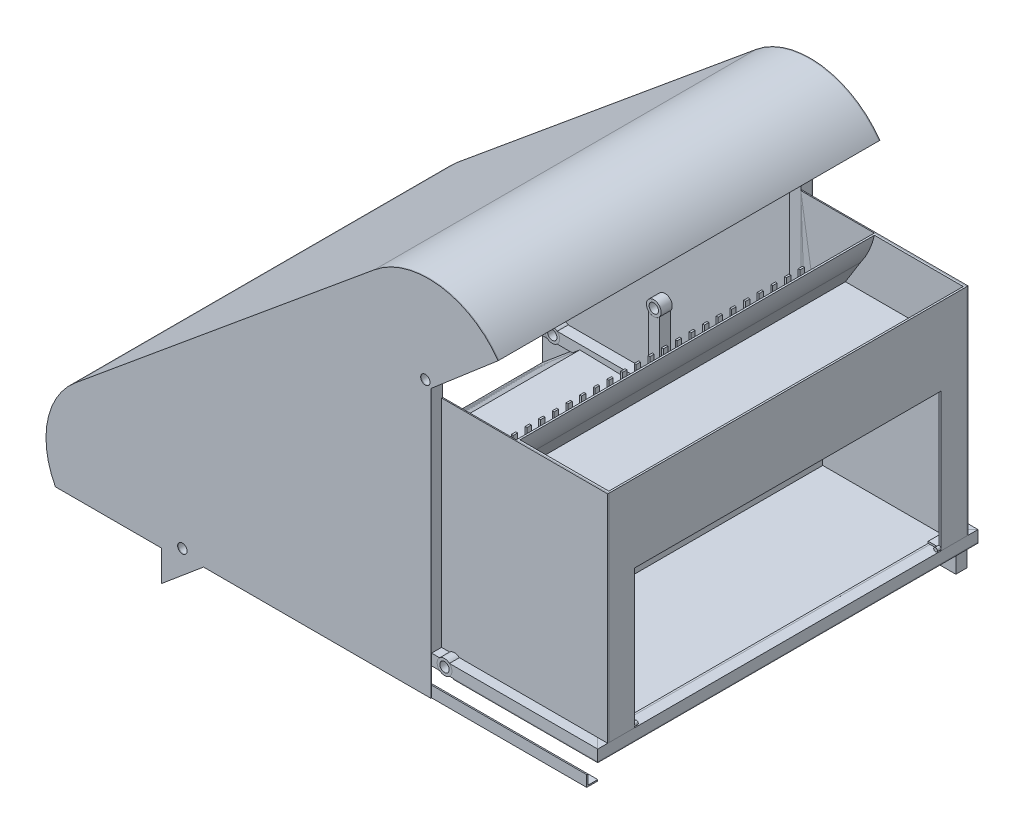
from build123d import *

# Parameters (mm, degrees)
RECTANGULAR_TUBE_SABOSQUARE_1_DEPTH      = 322.213254986
RECTANGULAR_TUBE_SABOSQUARE_1_DEPTH_BACK = 22.213203436
SKETCH11_W                               = 30
SKETCH11_H                               = 30
SKETCH11_W_2                             = 26
SKETCH11_H_2                             = 26
SKETCH11_ON_SEGMENT_2_W                  = 30
SKETCH11_ON_SEGMENT_2_H                  = 30
SKETCH11_ON_SEGMENT_2_W_2                = 26
SKETCH11_ON_SEGMENT_2_H_2                = 26
RECTANGULAR_TUBE_SABOSQUARE_1_2_DEPTH    = 1044.426406874
SKETCH11_ON_SEGMENT_3_W                  = 30
SKETCH11_ON_SEGMENT_3_H                  = 30
SKETCH11_ON_SEGMENT_3_W_2                = 26
SKETCH11_ON_SEGMENT_3_H_2                = 26
RECTANGULAR_TUBE_SABOSQUARE_1_3_DEPTH    = 344.426355321
SKETCH11_ON_SEGMENT_4_W                  = 30
SKETCH11_ON_SEGMENT_4_H                  = 30
SKETCH11_ON_SEGMENT_4_W_2                = 26
SKETCH11_ON_SEGMENT_4_H_2                = 26
RECTANGULAR_TUBE_SABOSQUARE_1_4_DEPTH    = 119.426406871
SKETCH11_ON_SEGMENT_5_W                  = 30
SKETCH11_ON_SEGMENT_5_H                  = 30
SKETCH11_ON_SEGMENT_5_W_2                = 26
SKETCH11_ON_SEGMENT_5_H_2                = 26
RECTANGULAR_TUBE_SABOSQUARE_1_5_DEPTH    = 553.34474334
SKETCH11_ON_SEGMENT_6_W                  = 30
SKETCH11_ON_SEGMENT_6_H                  = 30
SKETCH11_ON_SEGMENT_6_W_2                = 26
SKETCH11_ON_SEGMENT_6_H_2                = 26
RECTANGULAR_TUBE_SABOSQUARE_1_6_DEPTH    = 119.426406871
SKETCH11_ON_SEGMENT_7_W                  = 30
SKETCH11_ON_SEGMENT_7_H                  = 30
SKETCH11_ON_SEGMENT_7_W_2                = 26
SKETCH11_ON_SEGMENT_7_H_2                = 26
RECTANGULAR_TUBE_SABOSQUARE_1_7_DEPTH    = 694.42640773
SKETCH11_ON_SEGMENT_8_W                  = 30
SKETCH11_ON_SEGMENT_8_H                  = 30
SKETCH11_ON_SEGMENT_8_W_2                = 26
SKETCH11_ON_SEGMENT_8_H_2                = 26
RECTANGULAR_TUBE_SABOSQUARE_1_8_DEPTH    = 1044.426406871
SKETCH11_ON_SEGMENT_9_W                  = 30
SKETCH11_ON_SEGMENT_9_H                  = 30
SKETCH11_ON_SEGMENT_9_W_2                = 26
SKETCH11_ON_SEGMENT_9_H_2                = 26
RECTANGULAR_TUBE_SABOSQUARE_1_9_DEPTH    = 694.426365511
SKETCH11_ON_SEGMENT_10_W                 = 30
SKETCH11_ON_SEGMENT_10_H                 = 30
SKETCH11_ON_SEGMENT_10_W_2               = 26
SKETCH11_ON_SEGMENT_10_H_2               = 26
RECTANGULAR_TUBE_SABOSQUARE_1_10_DEPTH   = 119.426406871
SKETCH11_ON_SEGMENT_11_W                 = 30
SKETCH11_ON_SEGMENT_11_H                 = 30
SKETCH11_ON_SEGMENT_11_W_2               = 26
SKETCH11_ON_SEGMENT_11_H_2               = 26
RECTANGULAR_TUBE_SABOSQUARE_1_11_DEPTH   = 553.347173446
SKETCH11_ON_SEGMENT_12_W                 = 30
SKETCH11_ON_SEGMENT_12_H                 = 30
SKETCH11_ON_SEGMENT_12_W_2               = 26
SKETCH11_ON_SEGMENT_12_H_2               = 26
RECTANGULAR_TUBE_SABOSQUARE_1_12_DEPTH   = 119.426406871
SKETCH12_W                               = 30
SKETCH12_H                               = 30
SKETCH12_W_2                             = 26
SKETCH12_H_2                             = 26
RECTANGULAR_TUBE_SABOSQUARE_3_DEPTH      = 200
SKETCH12_ON_SEGMENT_2_W                  = 30
SKETCH12_ON_SEGMENT_2_H                  = 30
SKETCH12_ON_SEGMENT_2_W_2                = 26
SKETCH12_ON_SEGMENT_2_H_2                = 26
RECTANGULAR_TUBE_SABOSQUARE_3_2_DEPTH    = 200
SKETCH12_ON_SEGMENT_3_W                  = 30
SKETCH12_ON_SEGMENT_3_H                  = 30
SKETCH12_ON_SEGMENT_3_W_2                = 26
SKETCH12_ON_SEGMENT_3_H_2                = 26
RECTANGULAR_TUBE_SABOSQUARE_3_3_DEPTH    = 650
SKETCH12_ON_SEGMENT_4_W                  = 30
SKETCH12_ON_SEGMENT_4_H                  = 30
SKETCH12_ON_SEGMENT_4_W_2                = 26
SKETCH12_ON_SEGMENT_4_H_2                = 26
RECTANGULAR_TUBE_SABOSQUARE_3_4_DEPTH    = 650
SKETCH13_R                               = 20
SKETCH13_R_2                             = 12.7
BOSS_EXTRUDE1_DEPTH                      = 30
BOSS_EXTRUDE1_2_DEPTH                    = 30
BOSS_EXTRUDE1_3_DEPTH                    = 30
BOSS_EXTRUDE1_4_DEPTH                    = 30
BOSS_EXTRUDE1_5_DEPTH                    = 30
SKETCH15_R                               = 20
SKETCH15_R_2                             = 12.7
BOSS_EXTRUDE2_DEPTH                      = 30
BOSS_EXTRUDE2_2_DEPTH                    = 30
BOSS_EXTRUDE2_3_DEPTH                    = 30
BOSS_EXTRUDE2_4_DEPTH                    = 30
BOSS_EXTRUDE2_5_DEPTH                    = 30
TRIM_EXTEND1_START                       = -16
TRIM_EXTEND1_DEPTH                       = 31
TRIM_EXTEND1_START_2                     = 984
TRIM_EXTEND1_2_DEPTH                     = 32
TRIM_EXTEND1_3_OUTLINE_W                 = 30
TRIM_EXTEND1_3_OUTLINE_H                 = 15
TRIM_EXTEND1_3_DEPTH                     = 32
TRIM_EXTEND1_4_OUTLINE_W                 = 30
TRIM_EXTEND1_4_OUTLINE_H                 = 15
TRIM_EXTEND1_4_DEPTH                     = 32
TRIM_EXTEND1_START_3                     = -15
TRIM_EXTEND1_5_DEPTH                     = 30
TRIM_EXTEND1_6_DEPTH                     = 2
TRIM_EXTEND1_START_4                     = 13
TRIM_EXTEND1_7_DEPTH                     = 2
TRIM_EXTEND1_8_DEPTH                     = 30
TRIM_EXTEND1_9_DEPTH                     = 30
TRIM_EXTEND1_10_DEPTH                    = 30
TRIM_EXTEND1_11_DEPTH                    = 2
TRIM_EXTEND1_12_DEPTH                    = 2
TRIM_EXTEND1_START_5                     = 985
TRIM_EXTEND1_13_DEPTH                    = 30
TRIM_EXTEND1_14_DEPTH                    = 30
TRIM_EXTEND1_15_DEPTH                    = 2
TRIM_EXTEND1_START_6                     = 1013
TRIM_EXTEND1_16_DEPTH                    = 2
TRIM_EXTEND1_17_DEPTH                    = 30
TRIM_EXTEND1_18_DEPTH                    = 2
TRIM_EXTEND1_19_DEPTH                    = 2
TRIM_EXTEND1_20_DEPTH                    = 30
TRIM_EXTEND2_START                       = -15
TRIM_EXTEND2_DEPTH                       = 30
TRIM_EXTEND2_2_DEPTH                     = 2
TRIM_EXTEND2_START_2                     = 13
TRIM_EXTEND2_3_DEPTH                     = 2
TRIM_EXTEND2_4_DEPTH                     = 30
TRIM_EXTEND2_START_3                     = 985
TRIM_EXTEND2_5_DEPTH                     = 30
TRIM_EXTEND2_6_DEPTH                     = 30
TRIM_EXTEND2_7_DEPTH                     = 2
TRIM_EXTEND2_START_4                     = 1013
TRIM_EXTEND2_8_DEPTH                     = 2
EXTRUDE_THIN1_DEPTH                      = 1030
BOSS_EXTRUDE3_START                      = -30
BOSS_EXTRUDE3_DEPTH                      = 970
SHELL1_START                             = 20
SHELL1_DEPTH                             = 960
SKETCH20_R                               = 1.5
BOSS_EXTRUDE4_DEPTH                      = 5
SKETCH21_W                               = 80
SKETCH21_H                               = 960
CUT_EXTRUDE1_DEPTH                       = 289
SKETCH22_W                               = 324.999958892
SKETCH22_H                               = 960
BOSS_EXTRUDE5_DEPTH                      = 9.4631
BOSS_EXTRUDE6_DEPTH                      = 619.999958892
BOSS_EXTRUDE6_2_DEPTH                    = 619.999958892
SKETCH24_W                               = 390.52422962
SKETCH24_H                               = 1030
BOSS_EXTRUDE7_DEPTH                      = 2
EXTRUDE_THIN2_DEPTH                      = 970
SKETCH27_R                               = 12.7
BOSS_EXTRUDE8_DEPTH                      = 2
BOSS_EXTRUDE9_DEPTH                      = 30
LPATTERN1_COUNT                          = 2
LPATTERN1_PITCH                          = 1032
LPATTERN2_START                          = -15
LPATTERN2_DEPTH                          = 1030
SKETCH29_W                               = 830
SKETCH29_H                               = 374.860259804
CUT_EXTRUDE2_DEPTH                       = 37
SKETCH30_R                               = 5
BOSS_EXTRUDE10_DEPTH                     = 10
SKETCH32_R                               = 5
BOSS_EXTRUDE11_DEPTH                     = 10
SKETCH33_W                               = 449.999958892
SKETCH33_H                               = 3
BOSS_EXTRUDE13_DEPTH                     = 585
MIRROR6_START                            = 215
MIRROR6_OUTLINE_W                        = 585
MIRROR6_OUTLINE_H                        = 3
MIRROR6_DEPTH                            = 449.999958892
MIRROR6_START_2                          = 90
MIRROR6_2_OUTLINE_W                      = 449.999958892
MIRROR6_2_OUTLINE_H                      = 3
MIRROR6_2_DEPTH                          = 585
MIRROR6_START_3                          = 12
MIRROR6_3_OUTLINE_W                      = 449.999958892
MIRROR6_3_OUTLINE_H                      = 585
MIRROR6_3_DEPTH                          = 3
MIRROR6_4_DEPTH                          = 3
MIRROR6_5_OUTLINE_W                      = 449.999958892
MIRROR6_5_OUTLINE_H                      = 585
MIRROR6_5_DEPTH                          = 3
MIRROR6_6_DEPTH                          = 3
MIRROR6_7_OUTLINE_W                      = 585
MIRROR6_7_OUTLINE_H                      = 3
MIRROR6_7_DEPTH                          = 449.999958892


with BuildPart() as part:
    # Sketch11 → Rectangular tube SABOSQUARE(1) (new, two sides: drawn at the far end of the back side and taken through both)
    with BuildSketch(Plane(origin=(-508.920766574, 75, 1000), x_dir=(0, 0, 1), z_dir=(-1, 0, 0)).offset(-RECTANGULAR_TUBE_SABOSQUARE_1_DEPTH_BACK)):
        Rectangle(SKETCH11_W, SKETCH11_H)
        Rectangle(SKETCH11_W_2, SKETCH11_H_2, mode=Mode.SUBTRACT)
    extrude(amount=RECTANGULAR_TUBE_SABOSQUARE_1_DEPTH + RECTANGULAR_TUBE_SABOSQUARE_1_DEPTH_BACK)

    # Rectangular tube SABOSQUARE(1) mitre 1
    split(bisect_by=Plane(origin=(-508.920766574, 75, 1000), x_dir=(-0.707106781, -0.707106781, 0), z_dir=(-0.707106781, 0.707106781, 0)), keep=Keep.TOP)

    # Rectangular tube SABOSQUARE(1) mitre 2
    split(bisect_by=Plane(origin=(-808.920766574, 75, 1000), x_dir=(0, 1, 0), z_dir=(0.707105922, 0, 0.70710764)), keep=Keep.TOP)

    # Trim_Extend1 20 outline → Trim_Extend1 20 (cut)
    with BuildSketch(Plane.XY.offset(TRIM_EXTEND1_START_5)):
        with BuildLine():
            Line((-493.920766574, 90), (-622.14952313, 90))
            ThreePointArc((-622.14952313, 90), (-628.920766574, 75), (-622.14952313, 60))
            Line((-622.14952313, 60), (-523.920766574, 60))
            Line((-523.920766574, 60), (-493.920766574, 90))
        make_face()
    extrude(amount=TRIM_EXTEND1_20_DEPTH, mode=Mode.SUBTRACT)


with BuildPart() as body_2:
    # Sketch11 on segment 2 (carried to segment 2) → Rectangular tube SABOSQUARE_1 2 (new body)
    with BuildSketch(Plane(origin=(-808.920820555, 75, 1022.213254986), x_dir=(-1.0, 0, -2.43e-06), z_dir=(2.43e-06, 0, -1.0))):
        Rectangle(SKETCH11_ON_SEGMENT_2_W, SKETCH11_ON_SEGMENT_2_H)
        Rectangle(SKETCH11_ON_SEGMENT_2_W_2, SKETCH11_ON_SEGMENT_2_H_2, mode=Mode.SUBTRACT)
    extrude(amount=RECTANGULAR_TUBE_SABOSQUARE_1_2_DEPTH)

    # Rectangular tube SABOSQUARE_1 2 mitre 1
    split(bisect_by=Plane(origin=(-808.918336469, 75, 0), x_dir=(0, -1, 0), z_dir=(-0.70710764, 0, 0.707105922)), keep=Keep.TOP)

    # Rectangular tube SABOSQUARE_1 2 mitre 2
    split(bisect_by=Plane(origin=(-808.920766574, 75, 1000), x_dir=(0, -1, 0), z_dir=(-0.707105922, 0, -0.70710764)), keep=Keep.TOP)


with BuildPart() as body_3:
    # Sketch11 on segment 3 (carried to segment 3) → Rectangular tube SABOSQUARE_1 3 (new body)
    with BuildSketch(Plane(origin=(-831.131488354, 75, 0), x_dir=(0, 0, -1), z_dir=(1, 0, 0))):
        Rectangle(SKETCH11_ON_SEGMENT_3_W, SKETCH11_ON_SEGMENT_3_H)
        Rectangle(SKETCH11_ON_SEGMENT_3_W_2, SKETCH11_ON_SEGMENT_3_H_2, mode=Mode.SUBTRACT)
    extrude(amount=RECTANGULAR_TUBE_SABOSQUARE_1_3_DEPTH)

    # Rectangular tube SABOSQUARE_1 3 mitre 1
    split(bisect_by=Plane(origin=(-508.918336469, 75, 0), x_dir=(-0.707106781, -0.707106781, 0), z_dir=(-0.707106781, 0.707106781, 0)), keep=Keep.TOP)

    # Rectangular tube SABOSQUARE_1 3 mitre 2
    split(bisect_by=Plane(origin=(-808.918336469, 75, 0), x_dir=(0, 1, 0), z_dir=(0.70710764, 0, -0.707105922)), keep=Keep.TOP)

    # Trim_Extend1 9 outline → Trim_Extend1 9 (cut)
    with BuildSketch(Plane.XY.offset(TRIM_EXTEND1_START_3)):
        with BuildLine():
            Line((-622.14952313, 60), (-523.918336469, 60))
            Line((-523.918336469, 60), (-493.918336469, 90))
            Line((-493.918336469, 90), (-622.14952313, 90))
            ThreePointArc((-622.14952313, 90), (-628.920766574, 75), (-622.14952313, 60))
        make_face()
    extrude(amount=TRIM_EXTEND1_9_DEPTH, mode=Mode.SUBTRACT)


with BuildPart() as body_4:
    # Sketch11 on segment 4 (carried to segment 4) → Rectangular tube SABOSQUARE_1 4 (new body)
    with BuildSketch(Plane(origin=(-508.918336469, 97.213203436, 0), x_dir=(0, 0, 1), z_dir=(0, -1, 0))):
        Rectangle(SKETCH11_ON_SEGMENT_4_W, SKETCH11_ON_SEGMENT_4_H)
        Rectangle(SKETCH11_ON_SEGMENT_4_W_2, SKETCH11_ON_SEGMENT_4_H_2, mode=Mode.SUBTRACT)
    extrude(amount=RECTANGULAR_TUBE_SABOSQUARE_1_4_DEPTH)

    # Rectangular tube SABOSQUARE_1 4 mitre 1
    split(bisect_by=Plane(origin=(-508.918336469, 75, 0), x_dir=(0.707106781, 0.707106781, 0), z_dir=(0.707106781, -0.707106781, 0)), keep=Keep.TOP)

    # Rectangular tube SABOSQUARE_1 4 mitre 2
    split(bisect_by=Plane(origin=(-508.918336469, 0, 0), x_dir=(-0.707106781, -0.707106781, 0), z_dir=(-0.707106781, 0.707106781, 0)), keep=Keep.TOP)


with BuildPart() as body_5:
    # Sketch11 on segment 5 (carried to segment 5) → Rectangular tube SABOSQUARE_1 5 (new body)
    with BuildSketch(Plane(origin=(-531.131539904, 0, 0), x_dir=(0, 0, -1), z_dir=(1, 0, 0))):
        Rectangle(SKETCH11_ON_SEGMENT_5_W, SKETCH11_ON_SEGMENT_5_H)
        Rectangle(SKETCH11_ON_SEGMENT_5_W_2, SKETCH11_ON_SEGMENT_5_H_2, mode=Mode.SUBTRACT)
    extrude(amount=RECTANGULAR_TUBE_SABOSQUARE_1_5_DEPTH)

    # Rectangular tube SABOSQUARE_1 5 mitre 1
    split(bisect_by=Plane(origin=(-508.918336469, 0, 0), x_dir=(0.707106781, 0.707106781, 0), z_dir=(0.707106781, -0.707106781, 0)), keep=Keep.TOP)

    # Rectangular tube SABOSQUARE_1 5 mitre 2
    split(bisect_by=Plane(origin=(0, 0, 0), x_dir=(0.707106781, -0.707106781, 0), z_dir=(-0.707106781, -0.707106781, 0)), keep=Keep.TOP)

    # Trim_Extend1 8 outline → Trim_Extend1 8 (cut)
    with BuildSketch(Plane.XY.offset(TRIM_EXTEND1_START_3)):
        with BuildLine():
            Line((-444.901385165, 15), (-493.918336469, 15))
            Line((-493.918336469, 15), (-523.918336469, -15))
            Line((-523.918336469, -15), (-444.901385165, -15))
            ThreePointArc((-444.901385165, -15), (-438.130141721, 0), (-444.901385165, 15))
        make_face()
    extrude(amount=TRIM_EXTEND1_8_DEPTH, mode=Mode.SUBTRACT)


with BuildPart() as body_6:
    # Sketch11 on segment 6 (carried to segment 6) → Rectangular tube SABOSQUARE_1 6 (new body)
    with BuildSketch(Plane.ZX.offset(-22.213203436)):
        Rectangle(SKETCH11_ON_SEGMENT_6_W, SKETCH11_ON_SEGMENT_6_H)
        Rectangle(SKETCH11_ON_SEGMENT_6_W_2, SKETCH11_ON_SEGMENT_6_H_2, mode=Mode.SUBTRACT)
    extrude(amount=RECTANGULAR_TUBE_SABOSQUARE_1_6_DEPTH)

    # Rectangular tube SABOSQUARE_1 6 mitre 1
    split(bisect_by=Plane(origin=(0, 0, 0), x_dir=(-0.707106781, 0.707106781, 0), z_dir=(0.707106781, 0.707106781, 0)), keep=Keep.TOP)

    # Rectangular tube SABOSQUARE_1 6 mitre 2
    split(bisect_by=Plane(origin=(0, 75, 0), x_dir=(0.707106781, -0.707106781, 0), z_dir=(-0.707106781, -0.707106781, 0)), keep=Keep.TOP)


with BuildPart() as body_7:
    # Sketch11 on segment 7 (carried to segment 7) → Rectangular tube SABOSQUARE_1 7 (new body)
    with BuildSketch(Plane(origin=(-22.213203436, 75, 0), x_dir=(0, 0, -1), z_dir=(1, 0, 0))):
        Rectangle(SKETCH11_ON_SEGMENT_7_W, SKETCH11_ON_SEGMENT_7_H)
        Rectangle(SKETCH11_ON_SEGMENT_7_W_2, SKETCH11_ON_SEGMENT_7_H_2, mode=Mode.SUBTRACT)
    extrude(amount=RECTANGULAR_TUBE_SABOSQUARE_1_7_DEPTH)

    # Rectangular tube SABOSQUARE_1 7 mitre 1
    split(bisect_by=Plane(origin=(0, 75, 0), x_dir=(-0.707106781, 0.707106781, 0), z_dir=(0.707106781, 0.707106781, 0)), keep=Keep.TOP)

    # Rectangular tube SABOSQUARE_1 7 mitre 2
    split(bisect_by=Plane(origin=(650, 75, 0), x_dir=(0, -1, 0), z_dir=(-0.707106767, 0, -0.707106796)), keep=Keep.TOP)

    # Trim_Extend2 4 outline → Trim_Extend2 4 (cut)
    with BuildSketch(Plane.XY.offset(TRIM_EXTEND2_START)):
        with BuildLine():
            Line((263.228756555, 90), (-15, 90))
            Line((-15, 90), (15, 60))
            Line((15, 60), (263.228756555, 60))
            ThreePointArc((263.228756555, 60), (270, 75), (263.228756555, 90))
        make_face()
    extrude(amount=TRIM_EXTEND2_4_DEPTH, mode=Mode.SUBTRACT)

    # Mirror6 4 outline → Mirror6 4 (add)
    with BuildSketch(Plane.XY.offset(MIRROR6_START_3)):
        Polygon((215, 90), (664.999972797, 90), (664.999958892, 675), (215, 675), align=None)
    extrude(amount=MIRROR6_4_DEPTH)


with BuildPart() as body_8:
    # Sketch11 on segment 8 (carried to segment 8) → Rectangular tube SABOSQUARE_1 8 (new body)
    with BuildSketch(Plane(origin=(650.0000009, 75, -22.213204295), x_dir=(1.0, 0, 4.1e-08), z_dir=(-4.1e-08, 0, 1.0))):
        Rectangle(SKETCH11_ON_SEGMENT_8_W, SKETCH11_ON_SEGMENT_8_H)
        Rectangle(SKETCH11_ON_SEGMENT_8_W_2, SKETCH11_ON_SEGMENT_8_H_2, mode=Mode.SUBTRACT)
    extrude(amount=RECTANGULAR_TUBE_SABOSQUARE_1_8_DEPTH)

    # Rectangular tube SABOSQUARE_1 8 mitre 1
    split(bisect_by=Plane(origin=(650, 75, 0), x_dir=(0, 1, 0), z_dir=(0.707106767, 0, 0.707106796)), keep=Keep.TOP)

    # Rectangular tube SABOSQUARE_1 8 mitre 2
    split(bisect_by=Plane(origin=(649.999959499, 75, 1000), x_dir=(0, 1, 0), z_dir=(0.707106796, 0, -0.707106767)), keep=Keep.TOP)

    # Mirror6 7 outline → Mirror6 7 (add)
    with BuildSketch(Plane.YZ.offset(MIRROR6_START)):
        with Locations((382.5, 13.5)):
            Rectangle(MIRROR6_7_OUTLINE_W, MIRROR6_7_OUTLINE_H)
    extrude(amount=MIRROR6_7_DEPTH)


with BuildPart() as body_9:
    # Sketch11 on segment 9 (carried to segment 9) → Rectangular tube SABOSQUARE_1 9 (new body)
    with BuildSketch(Plane(origin=(672.213162076, 75, 1000), x_dir=(0, 0, 1), z_dir=(-1, 0, 0))):
        Rectangle(SKETCH11_ON_SEGMENT_9_W, SKETCH11_ON_SEGMENT_9_H)
        Rectangle(SKETCH11_ON_SEGMENT_9_W_2, SKETCH11_ON_SEGMENT_9_H_2, mode=Mode.SUBTRACT)
    extrude(amount=RECTANGULAR_TUBE_SABOSQUARE_1_9_DEPTH)

    # Rectangular tube SABOSQUARE_1 9 mitre 1
    split(bisect_by=Plane(origin=(0, 75, 1000), x_dir=(-0.707106781, 0.707106781, 0), z_dir=(0.707106781, 0.707106781, 0)), keep=Keep.TOP)

    # Rectangular tube SABOSQUARE_1 9 mitre 2
    split(bisect_by=Plane(origin=(649.999959499, 75, 1000), x_dir=(0, -1, 0), z_dir=(-0.707106796, 0, 0.707106767)), keep=Keep.TOP)

    # Trim_Extend2 5 outline → Trim_Extend2 5 (cut)
    with BuildSketch(Plane.XY.offset(TRIM_EXTEND2_START_3)):
        with BuildLine():
            Line((15, 60), (263.228756555, 60))
            ThreePointArc((263.228756555, 60), (270, 75), (263.228756555, 90))
            Line((263.228756555, 90), (-15, 90))
            Line((-15, 90), (15, 60))
        make_face()
    extrude(amount=TRIM_EXTEND2_5_DEPTH, mode=Mode.SUBTRACT)


with BuildPart() as body_10:
    # Sketch11 on segment 10 (carried to segment 10) → Rectangular tube SABOSQUARE_1 10 (new body)
    with BuildSketch(Plane(origin=(0, 97.213203436, 1000), x_dir=(0, 0, 1), z_dir=(0, -1, 0))):
        Rectangle(SKETCH11_ON_SEGMENT_10_W, SKETCH11_ON_SEGMENT_10_H)
        Rectangle(SKETCH11_ON_SEGMENT_10_W_2, SKETCH11_ON_SEGMENT_10_H_2, mode=Mode.SUBTRACT)
    extrude(amount=RECTANGULAR_TUBE_SABOSQUARE_1_10_DEPTH)

    # Rectangular tube SABOSQUARE_1 10 mitre 1
    split(bisect_by=Plane(origin=(0, 0, 1000), x_dir=(-0.707106781, 0.707106781, 0), z_dir=(0.707106781, 0.707106781, 0)), keep=Keep.TOP)

    # Rectangular tube SABOSQUARE_1 10 mitre 2
    split(bisect_by=Plane(origin=(0, 75, 1000), x_dir=(0.707106781, -0.707106781, 0), z_dir=(-0.707106781, -0.707106781, 0)), keep=Keep.TOP)


with BuildPart() as body_11:
    # Sketch11 on segment 11 (carried to segment 11) → Rectangular tube SABOSQUARE_1 11 (new body)
    with BuildSketch(Plane(origin=(22.213203436, 0, 1000), x_dir=(0, 0, 1), z_dir=(-1, 0, 0))):
        Rectangle(SKETCH11_ON_SEGMENT_11_W, SKETCH11_ON_SEGMENT_11_H)
        Rectangle(SKETCH11_ON_SEGMENT_11_W_2, SKETCH11_ON_SEGMENT_11_H_2, mode=Mode.SUBTRACT)
    extrude(amount=RECTANGULAR_TUBE_SABOSQUARE_1_11_DEPTH)

    # Rectangular tube SABOSQUARE_1 11 mitre 1
    split(bisect_by=Plane(origin=(-508.920766574, 0, 1000), x_dir=(0.707106781, 0.707106781, 0), z_dir=(0.707106781, -0.707106781, 0)), keep=Keep.TOP)

    # Rectangular tube SABOSQUARE_1 11 mitre 2
    split(bisect_by=Plane(origin=(0, 0, 1000), x_dir=(0.707106781, -0.707106781, 0), z_dir=(-0.707106781, -0.707106781, 0)), keep=Keep.TOP)

    # Trim_Extend1 13 outline → Trim_Extend1 13 (cut)
    with BuildSketch(Plane.XY.offset(TRIM_EXTEND1_START_5)):
        with BuildLine():
            Line((-523.920766574, -15), (-444.901385165, -15))
            ThreePointArc((-444.901385165, -15), (-438.130141721, 0), (-444.901385165, 15))
            Line((-444.901385165, 15), (-493.920766574, 15))
            Line((-493.920766574, 15), (-523.920766574, -15))
        make_face()
    extrude(amount=TRIM_EXTEND1_13_DEPTH, mode=Mode.SUBTRACT)


with BuildPart() as body_12:
    # Sketch11 on segment 12 (carried to segment 12) → Rectangular tube SABOSQUARE_1 12 (new body)
    with BuildSketch(Plane(origin=(-508.920766574, -22.213203436, 1000), x_dir=(0, 0, 1), z_dir=(0, 1, 0))):
        Rectangle(SKETCH11_ON_SEGMENT_12_W, SKETCH11_ON_SEGMENT_12_H)
        Rectangle(SKETCH11_ON_SEGMENT_12_W_2, SKETCH11_ON_SEGMENT_12_H_2, mode=Mode.SUBTRACT)
    extrude(amount=RECTANGULAR_TUBE_SABOSQUARE_1_12_DEPTH)

    # Rectangular tube SABOSQUARE_1 12 mitre 1
    split(bisect_by=Plane(origin=(-508.920766574, 75, 1000), x_dir=(0.707106781, 0.707106781, 0), z_dir=(0.707106781, -0.707106781, 0)), keep=Keep.TOP)

    # Rectangular tube SABOSQUARE_1 12 mitre 2
    split(bisect_by=Plane(origin=(-508.920766574, 0, 1000), x_dir=(-0.707106781, -0.707106781, 0), z_dir=(-0.707106781, 0.707106781, 0)), keep=Keep.TOP)


with BuildPart() as body_13:
    # Sketch12 → Rectangular tube SABOSQUARE(3) (new body)
    with BuildSketch(Plane(origin=(-183.130141721, 0, 1000), x_dir=(1, 0, 0), z_dir=(0, 1, 0))):
        Rectangle(SKETCH12_W, SKETCH12_H)
        Rectangle(SKETCH12_W_2, SKETCH12_H_2, mode=Mode.SUBTRACT)
    extrude(amount=RECTANGULAR_TUBE_SABOSQUARE_3_DEPTH)

    # Trim_Extend1 2 outline → Trim_Extend1 2 (cut)
    with BuildSketch(Plane.XY.offset(TRIM_EXTEND1_START_2)):
        with BuildLine():
            Line((-198.130141721, 200), (-198.130141721, 186.771243445))
            ThreePointArc((-198.130141721, 186.771243445), (-183.130141721, 180), (-168.130141721, 186.771243445))
            Line((-168.130141721, 186.771243445), (-168.130141721, 200))
            Line((-168.130141721, 200), (-198.130141721, 200))
        make_face()
    extrude(amount=TRIM_EXTEND1_2_DEPTH, mode=Mode.SUBTRACT)


with BuildPart() as body_14:
    # Sketch12 on segment 2 (carried to segment 2) → Rectangular tube SABOSQUARE_3 2 (new body)
    with BuildSketch(Plane(origin=(-183.130141721, 0, 0), x_dir=(1, 0, 0), z_dir=(0, 1, 0))):
        Rectangle(SKETCH12_ON_SEGMENT_2_W, SKETCH12_ON_SEGMENT_2_H)
        Rectangle(SKETCH12_ON_SEGMENT_2_W_2, SKETCH12_ON_SEGMENT_2_H_2, mode=Mode.SUBTRACT)
    extrude(amount=RECTANGULAR_TUBE_SABOSQUARE_3_2_DEPTH)

    # Trim/Extend1: read off the stored shape, not the designer's step
    # Trim/Extend1 outline → Trim/Extend1 (cut)
    with BuildSketch(Plane.XY.offset(TRIM_EXTEND1_START)):
        with BuildLine():
            Line((-168.130141721, 186.771243445), (-168.130141721, 200))
            Line((-168.130141721, 200), (-198.130141721, 200))
            Line((-198.130141721, 200), (-198.130141721, 186.771243445))
            ThreePointArc((-198.130141721, 186.771243445), (-183.130141721, 180), (-168.130141721, 186.771243445))
        make_face()
    extrude(amount=TRIM_EXTEND1_DEPTH, mode=Mode.SUBTRACT)


with BuildPart() as body_15:
    # Sketch12 on segment 3 (carried to segment 3) → Rectangular tube SABOSQUARE_3 3 (new body)
    with BuildSketch(Plane(origin=(200, 75, 1000), x_dir=(1, 0, 0), z_dir=(0, 1, 0))):
        Rectangle(SKETCH12_ON_SEGMENT_3_W, SKETCH12_ON_SEGMENT_3_H)
        Rectangle(SKETCH12_ON_SEGMENT_3_W_2, SKETCH12_ON_SEGMENT_3_H_2, mode=Mode.SUBTRACT)
    extrude(amount=RECTANGULAR_TUBE_SABOSQUARE_3_3_DEPTH)

    # Trim_Extend1 4 outline → Trim_Extend1 4 (cut)
    with BuildSketch(Plane.XY.offset(TRIM_EXTEND1_START_2)):
        with Locations((200, 82.5)):
            Rectangle(TRIM_EXTEND1_4_OUTLINE_W, TRIM_EXTEND1_4_OUTLINE_H)
        with BuildLine():
            Line((185, 725), (185, 711.771243445))
            ThreePointArc((185, 711.771243445), (200, 705), (215, 711.771243445))
            Line((215, 711.771243445), (215, 725))
            Line((215, 725), (185, 725))
        make_face()
    extrude(amount=TRIM_EXTEND1_4_DEPTH, mode=Mode.SUBTRACT)


with BuildPart() as body_16:
    # Sketch12 on segment 4 (carried to segment 4) → Rectangular tube SABOSQUARE_3 4 (new body)
    with BuildSketch(Plane(origin=(200, 75, 0), x_dir=(1, 0, 0), z_dir=(0, 1, 0))):
        Rectangle(SKETCH12_ON_SEGMENT_4_W, SKETCH12_ON_SEGMENT_4_H)
        Rectangle(SKETCH12_ON_SEGMENT_4_W_2, SKETCH12_ON_SEGMENT_4_H_2, mode=Mode.SUBTRACT)
    extrude(amount=RECTANGULAR_TUBE_SABOSQUARE_3_4_DEPTH)

    # Trim_Extend1 3 outline → Trim_Extend1 3 (cut)
    with BuildSketch(Plane.XY.offset(TRIM_EXTEND1_START)):
        with Locations((200, 82.5)):
            Rectangle(TRIM_EXTEND1_3_OUTLINE_W, TRIM_EXTEND1_3_OUTLINE_H)
        with BuildLine():
            Line((185, 725), (185, 711.771243445))
            ThreePointArc((185, 711.771243445), (200, 705), (215, 711.771243445))
            Line((215, 711.771243445), (215, 725))
            Line((215, 725), (185, 725))
        make_face()
    extrude(amount=TRIM_EXTEND1_3_DEPTH, mode=Mode.SUBTRACT)

    # Mirror6 5 outline → Mirror6 5 (add)
    with BuildSketch(Plane.XY.offset(MIRROR6_START_3)):
        with Locations((439.999979446, 382.5)):
            Rectangle(MIRROR6_5_OUTLINE_W, MIRROR6_5_OUTLINE_H)
    extrude(amount=MIRROR6_5_DEPTH)


with BuildPart() as body_17:
    # Sketch13 → Boss-Extrude1 (new body)
    with BuildSketch(Plane.XY.offset(1015)):
        with Locations((-608.920766574, 75)):
            Circle(SKETCH13_R)
        with Locations((-608.920766574, 75)):
            Circle(SKETCH13_R_2, mode=Mode.SUBTRACT)
    extrude(amount=-BOSS_EXTRUDE1_DEPTH)


with BuildPart() as body_18:
    # Sketch13 → Boss-Extrude1 2 (new body)
    with BuildSketch(Plane.XY.offset(1015)):
        with Locations((-458.130141721, 0)):
            Circle(SKETCH13_R)
        with Locations((-458.130141721, 0)):
            Circle(SKETCH13_R_2, mode=Mode.SUBTRACT)
    extrude(amount=-BOSS_EXTRUDE1_2_DEPTH)


with BuildPart() as body_19:
    # Sketch13 → Boss-Extrude1 3 (new body)
    with BuildSketch(Plane.XY.offset(1015)):
        with Locations((250, 75)):
            Circle(SKETCH13_R)
        with Locations((250, 75)):
            Circle(SKETCH13_R_2, mode=Mode.SUBTRACT)
    extrude(amount=-BOSS_EXTRUDE1_3_DEPTH)


with BuildPart() as body_20:
    # Sketch13 → Boss-Extrude1 4 (new body)
    with BuildSketch(Plane.XY.offset(1015)):
        with Locations((-183.130141721, 200)):
            Circle(SKETCH13_R)
        with Locations((-183.130141721, 200)):
            Circle(SKETCH13_R_2, mode=Mode.SUBTRACT)
    extrude(amount=-BOSS_EXTRUDE1_4_DEPTH)


with BuildPart() as body_21:
    # Sketch13 → Boss-Extrude1 5 (new body)
    with BuildSketch(Plane.XY.offset(1015)):
        with Locations((200, 725)):
            Circle(SKETCH13_R)
        with Locations((200, 725)):
            Circle(SKETCH13_R_2, mode=Mode.SUBTRACT)
    extrude(amount=-BOSS_EXTRUDE1_5_DEPTH)


with BuildPart() as body_22:
    # Sketch15 → Boss-Extrude2 (new body)
    with BuildSketch(Plane(origin=(0, 0, -15), x_dir=(-1, 0, 0), z_dir=(0, 0, -1))):
        with Locations((458.130141721, 0)):
            Circle(SKETCH15_R)
        with Locations((458.130141721, 0)):
            Circle(SKETCH15_R_2, mode=Mode.SUBTRACT)
    extrude(amount=-BOSS_EXTRUDE2_DEPTH)


with BuildPart() as body_23:
    # Sketch15 → Boss-Extrude2 2 (new body)
    with BuildSketch(Plane(origin=(0, 0, -15), x_dir=(-1, 0, 0), z_dir=(0, 0, -1))):
        with Locations((608.920766574, 75)):
            Circle(SKETCH15_R)
        with Locations((608.920766574, 75)):
            Circle(SKETCH15_R_2, mode=Mode.SUBTRACT)
    extrude(amount=-BOSS_EXTRUDE2_2_DEPTH)


with BuildPart() as body_24:
    # Sketch15 → Boss-Extrude2 3 (new body)
    with BuildSketch(Plane(origin=(0, 0, -15), x_dir=(-1, 0, 0), z_dir=(0, 0, -1))):
        with Locations((-250, 75)):
            Circle(SKETCH15_R)
        with Locations((-250, 75)):
            Circle(SKETCH15_R_2, mode=Mode.SUBTRACT)
    extrude(amount=-BOSS_EXTRUDE2_3_DEPTH)

    # Mirror6 6 outline → Mirror6 6 (add)
    with BuildSketch(Plane.XY.offset(MIRROR6_START_3)):
        with BuildLine():
            Line((263.228756555, 90), (664.999958892, 90))
            Line((664.999958892, 90), (664.999958892, 675))
            Line((664.999958892, 675), (215, 675))
            Line((215, 675), (215, 90))
            Line((215, 90), (236.771243445, 90))
            ThreePointArc((236.771243445, 90), (250, 95), (263.228756555, 90))
        make_face()
    extrude(amount=MIRROR6_6_DEPTH)


with BuildPart() as body_25:
    # Sketch15 → Boss-Extrude2 4 (new body)
    with BuildSketch(Plane(origin=(0, 0, -15), x_dir=(-1, 0, 0), z_dir=(0, 0, -1))):
        with Locations((183.130141721, 200)):
            Circle(SKETCH15_R)
        with Locations((183.130141721, 200)):
            Circle(SKETCH15_R_2, mode=Mode.SUBTRACT)
    extrude(amount=-BOSS_EXTRUDE2_4_DEPTH)


with BuildPart() as body_26:
    # Sketch15 → Boss-Extrude2 5 (new body)
    with BuildSketch(Plane(origin=(0, 0, -15), x_dir=(-1, 0, 0), z_dir=(0, 0, -1))):
        with Locations((-200, 725)):
            Circle(SKETCH15_R)
        with Locations((-200, 725)):
            Circle(SKETCH15_R_2, mode=Mode.SUBTRACT)
    extrude(amount=-BOSS_EXTRUDE2_5_DEPTH)


with BuildPart() as body_27:
    # Trim_Extend1 5 outline → Trim_Extend1 5 (new body)
    with BuildSketch(Plane.XY.offset(TRIM_EXTEND1_START_3)):
        with BuildLine():
            Line((-493.918336469, 15), (-495.918336469, 13))
            Line((-495.918336469, 13), (-473.328825874, 13))
            ThreePointArc((-473.328825874, 13), (-472.378995931, 14.034605577), (-471.358898276, 15))
            Line((-471.358898276, 15), (-493.918336469, 15))
        make_face()
        with BuildLine():
            Line((-473.328825874, -13), (-521.918336469, -13))
            Line((-521.918336469, -13), (-523.918336469, -15))
            Line((-523.918336469, -15), (-471.358898276, -15))
            ThreePointArc((-471.358898276, -15), (-472.378995931, -14.034605577), (-473.328825874, -13))
        make_face()
    extrude(amount=TRIM_EXTEND1_5_DEPTH)

    # Trim_Extend1 6 outline → Trim_Extend1 6 (add)
    with BuildSketch(Plane.XY.offset(TRIM_EXTEND1_START_3)):
        with BuildLine():
            Line((-473.328825874, 13), (-495.918336469, 13))
            Line((-495.918336469, 13), (-521.918336469, -13))
            Line((-521.918336469, -13), (-473.328825874, -13))
            ThreePointArc((-473.328825874, -13), (-478.130141721, 0), (-473.328825874, 13))
        make_face()
    extrude(amount=TRIM_EXTEND1_6_DEPTH)

    # Trim_Extend1 7 outline → Trim_Extend1 7 (add)
    with BuildSketch(Plane.XY.offset(TRIM_EXTEND1_START_4)):
        with BuildLine():
            Line((-473.328825874, 13), (-495.918336469, 13))
            Line((-495.918336469, 13), (-521.918336469, -13))
            Line((-521.918336469, -13), (-473.328825874, -13))
            ThreePointArc((-473.328825874, -13), (-478.130141721, 0), (-473.328825874, 13))
        make_face()
    extrude(amount=TRIM_EXTEND1_7_DEPTH)


with BuildPart() as body_28:
    # Trim_Extend1 10 outline → Trim_Extend1 10 (new body)
    with BuildSketch(Plane.XY.offset(TRIM_EXTEND1_START_3)):
        with BuildLine():
            Line((-595.692010019, 60), (-523.918336469, 60))
            Line((-523.918336469, 60), (-521.918336469, 62))
            Line((-521.918336469, 62), (-593.722082421, 62))
            ThreePointArc((-593.722082421, 62), (-594.671912364, 60.965394423), (-595.692010019, 60))
        make_face()
        with BuildLine():
            Line((-593.722082421, 88), (-495.918336469, 88))
            Line((-495.918336469, 88), (-493.918336469, 90))
            Line((-493.918336469, 90), (-595.692010019, 90))
            ThreePointArc((-595.692010019, 90), (-594.671912364, 89.034605577), (-593.722082421, 88))
        make_face()
    extrude(amount=TRIM_EXTEND1_10_DEPTH)

    # Trim_Extend1 11 outline → Trim_Extend1 11 (add)
    with BuildSketch(Plane.XY.offset(TRIM_EXTEND1_START_3)):
        with BuildLine():
            Line((-593.722082421, 62), (-521.918336469, 62))
            Line((-521.918336469, 62), (-495.918336469, 88))
            Line((-495.918336469, 88), (-593.722082421, 88))
            ThreePointArc((-593.722082421, 88), (-588.920766574, 75), (-593.722082421, 62))
        make_face()
    extrude(amount=TRIM_EXTEND1_11_DEPTH)

    # Trim_Extend1 12 outline → Trim_Extend1 12 (add)
    with BuildSketch(Plane.XY.offset(TRIM_EXTEND1_START_4)):
        with BuildLine():
            Line((-593.722082421, 62), (-521.918336469, 62))
            Line((-521.918336469, 62), (-495.918336469, 88))
            Line((-495.918336469, 88), (-593.722082421, 88))
            ThreePointArc((-593.722082421, 88), (-588.920766574, 75), (-593.722082421, 62))
        make_face()
    extrude(amount=TRIM_EXTEND1_12_DEPTH)


with BuildPart() as body_29:
    # Trim_Extend1 14 outline → Trim_Extend1 14 (new body)
    with BuildSketch(Plane.XY.offset(TRIM_EXTEND1_START_5)):
        with BuildLine():
            Line((-471.358898276, 15), (-493.920766574, 15))
            Line((-493.920766574, 15), (-495.920766574, 13))
            Line((-495.920766574, 13), (-473.328825874, 13))
            ThreePointArc((-473.328825874, 13), (-472.378995931, 14.034605577), (-471.358898276, 15))
        make_face()
        with BuildLine():
            Line((-473.328825874, -13), (-521.920766574, -13))
            Line((-521.920766574, -13), (-523.920766574, -15))
            Line((-523.920766574, -15), (-471.358898276, -15))
            ThreePointArc((-471.358898276, -15), (-472.378995931, -14.034605577), (-473.328825874, -13))
        make_face()
    extrude(amount=TRIM_EXTEND1_14_DEPTH)

    # Trim_Extend1 15 outline → Trim_Extend1 15 (add)
    with BuildSketch(Plane.XY.offset(TRIM_EXTEND1_START_5)):
        with BuildLine():
            Line((-473.328825874, 13), (-495.920766574, 13))
            Line((-495.920766574, 13), (-521.920766574, -13))
            Line((-521.920766574, -13), (-473.328825874, -13))
            ThreePointArc((-473.328825874, -13), (-478.130141721, 0), (-473.328825874, 13))
        make_face()
    extrude(amount=TRIM_EXTEND1_15_DEPTH)

    # Trim_Extend1 16 outline → Trim_Extend1 16 (add)
    with BuildSketch(Plane.XY.offset(TRIM_EXTEND1_START_6)):
        with BuildLine():
            Line((-473.328825874, 13), (-495.920766574, 13))
            Line((-495.920766574, 13), (-521.920766574, -13))
            Line((-521.920766574, -13), (-473.328825874, -13))
            ThreePointArc((-473.328825874, -13), (-478.130141721, 0), (-473.328825874, 13))
        make_face()
    extrude(amount=TRIM_EXTEND1_16_DEPTH)


with BuildPart() as body_30:
    # Trim_Extend1 17 outline → Trim_Extend1 17 (new body)
    with BuildSketch(Plane.XY.offset(TRIM_EXTEND1_START_5)):
        with BuildLine():
            ThreePointArc((-595.692010019, 90), (-594.671912364, 89.034605577), (-593.722082421, 88))
            Line((-593.722082421, 88), (-495.920766574, 88))
            Line((-495.920766574, 88), (-493.920766574, 90))
            Line((-493.920766574, 90), (-595.692010019, 90))
        make_face()
        with BuildLine():
            Line((-521.920766574, 62), (-593.722082421, 62))
            ThreePointArc((-593.722082421, 62), (-594.671912364, 60.965394423), (-595.692010019, 60))
            Line((-595.692010019, 60), (-523.920766574, 60))
            Line((-523.920766574, 60), (-521.920766574, 62))
        make_face()
    extrude(amount=TRIM_EXTEND1_17_DEPTH)

    # Trim_Extend1 18 outline → Trim_Extend1 18 (add)
    with BuildSketch(Plane.XY.offset(TRIM_EXTEND1_START_5)):
        with BuildLine():
            Line((-495.920766574, 88), (-593.722082421, 88))
            ThreePointArc((-593.722082421, 88), (-588.920766574, 75), (-593.722082421, 62))
            Line((-593.722082421, 62), (-521.920766574, 62))
            Line((-521.920766574, 62), (-495.920766574, 88))
        make_face()
    extrude(amount=TRIM_EXTEND1_18_DEPTH)

    # Trim_Extend1 19 outline → Trim_Extend1 19 (add)
    with BuildSketch(Plane.XY.offset(TRIM_EXTEND1_START_6)):
        with BuildLine():
            Line((-495.920766574, 88), (-593.722082421, 88))
            ThreePointArc((-593.722082421, 88), (-588.920766574, 75), (-593.722082421, 62))
            Line((-593.722082421, 62), (-521.920766574, 62))
            Line((-521.920766574, 62), (-495.920766574, 88))
        make_face()
    extrude(amount=TRIM_EXTEND1_19_DEPTH)


with BuildPart() as body_31:
    # Trim/Extend2: read off the stored shape, not the designer's step
    # Trim/Extend2 outline → Trim/Extend2 (new body)
    with BuildSketch(Plane.XY.offset(TRIM_EXTEND2_START)):
        with BuildLine():
            Line((-15, 90), (-13, 88))
            Line((-13, 88), (234.801315846, 88))
            ThreePointArc((234.801315846, 88), (235.75114579, 89.034605576), (236.771243445, 90))
            Line((236.771243445, 90), (-15, 90))
        make_face()
        with BuildLine():
            Line((234.801315846, 62), (13, 62))
            Line((13, 62), (15, 60))
            Line((15, 60), (236.771243445, 60))
            ThreePointArc((236.771243445, 60), (235.75114579, 60.965394424), (234.801315846, 62))
        make_face()
    extrude(amount=TRIM_EXTEND2_DEPTH)

    # Trim_Extend2 2 outline → Trim_Extend2 2 (add)
    with BuildSketch(Plane.XY.offset(TRIM_EXTEND2_START)):
        with BuildLine():
            Line((234.801315846, 88), (-13, 88))
            Line((-13, 88), (13, 62))
            Line((13, 62), (234.801315846, 62))
            ThreePointArc((234.801315846, 62), (230, 75), (234.801315846, 88))
        make_face()
    extrude(amount=TRIM_EXTEND2_2_DEPTH)

    # Trim_Extend2 3 outline → Trim_Extend2 3 (add)
    with BuildSketch(Plane.XY.offset(TRIM_EXTEND2_START_2)):
        with BuildLine():
            Line((234.801315846, 88), (-13, 88))
            Line((-13, 88), (13, 62))
            Line((13, 62), (234.801315846, 62))
            ThreePointArc((234.801315846, 62), (230, 75), (234.801315846, 88))
        make_face()
    extrude(amount=TRIM_EXTEND2_3_DEPTH)

    # Mirror6 3 outline → Mirror6 3 (add)
    with BuildSketch(Plane.XY.offset(MIRROR6_START_3)):
        with Locations((439.999979446, 382.5)):
            Rectangle(MIRROR6_3_OUTLINE_W, MIRROR6_3_OUTLINE_H)
    extrude(amount=MIRROR6_3_DEPTH)


with BuildPart() as body_32:
    # Trim_Extend2 6 outline → Trim_Extend2 6 (new body)
    with BuildSketch(Plane.XY.offset(TRIM_EXTEND2_START_3)):
        with BuildLine():
            Line((236.771243445, 90), (-15, 90))
            Line((-15, 90), (-13, 88))
            Line((-13, 88), (234.801315846, 88))
            ThreePointArc((234.801315846, 88), (235.75114579, 89.034605576), (236.771243445, 90))
        make_face()
        with BuildLine():
            Line((234.801315846, 62), (13, 62))
            Line((13, 62), (15, 60))
            Line((15, 60), (236.771243445, 60))
            ThreePointArc((236.771243445, 60), (235.75114579, 60.965394424), (234.801315846, 62))
        make_face()
    extrude(amount=TRIM_EXTEND2_6_DEPTH)

    # Trim_Extend2 7 outline → Trim_Extend2 7 (add)
    with BuildSketch(Plane.XY.offset(TRIM_EXTEND2_START_3)):
        with BuildLine():
            Line((234.801315846, 88), (-13, 88))
            Line((-13, 88), (13, 62))
            Line((13, 62), (234.801315846, 62))
            ThreePointArc((234.801315846, 62), (230, 75), (234.801315846, 88))
        make_face()
    extrude(amount=TRIM_EXTEND2_7_DEPTH)

    # Trim_Extend2 8 outline → Trim_Extend2 8 (add)
    with BuildSketch(Plane.XY.offset(TRIM_EXTEND2_START_4)):
        with BuildLine():
            Line((234.801315846, 88), (-13, 88))
            Line((-13, 88), (13, 62))
            Line((13, 62), (234.801315846, 62))
            ThreePointArc((234.801315846, 62), (230, 75), (234.801315846, 88))
        make_face()
    extrude(amount=TRIM_EXTEND2_8_DEPTH)


with BuildPart() as body_33:
    # Sketch17 → Extrude-Thin1 (new body)
    with BuildSketch(Plane.XY.offset(1015)):
        with BuildLine():
            ThreePointArc((-799.346631013, -25.935651913), (-820.31312645, 116.991497479), (-746.311174499, 241.053881269))
            Line((-746.311174499, 241.053881269), (63.869049265, 911.384442558))
            ThreePointArc((63.869049265, 911.384442558), (239.180250143, 961.362802196), (394.660218808, 866.190154186))
            Line((394.660218808, 866.190154186), (397.122576543, 867.903861975))
            ThreePointArc((397.122576543, 867.903861975), (239.586351949, 964.335188665), (61.956622843, 913.695854504))
            Line((61.956622843, 913.695854504), (-748.223600921, 243.365293214))
            ThreePointArc((-748.223600921, 243.365293214), (-823.255634159, 117.576004436), (-801.997292439, -27.340640882))
            Line((-801.997292439, -27.340640882), (-799.346631013, -25.935651913))
        make_face()
    extrude(amount=-EXTRUDE_THIN1_DEPTH)


with BuildPart() as body_34:
    # Sketch18 → Boss-Extrude3 (new body)
    with BuildSketch(Plane.XY.offset(1015).offset(BOSS_EXTRUDE3_START)):
        with BuildLine():
            Line((274.475729272, 60), (634.999958892, 60))
            Line((634.999958892, 60), (634.999958892, 90))
            Line((634.999958892, 90), (664.999958892, 90))
            Line((664.999958892, 90), (664.999958892, 675))
            Line((664.999958892, 675), (634.999958892, 675))
            Line((634.999958892, 675), (414.242852856, 675))
            ThreePointArc((414.242852856, 675), (399.985989758, 633.317919415), (377.710457064, 595.311937905))
            Line((377.710457064, 595.311937905), (250, 390.099033337))
            Line((250, 390.099033337), (250, 102.27559349))
            Line((250, 102.27559349), (274.475729272, 102.27559349))
            Line((274.475729272, 102.27559349), (274.475729272, 60))
        make_face()
    extrude(amount=-BOSS_EXTRUDE3_DEPTH)

    # Shell1: read off the stored shape, not the designer's step
    # Shell1 outline → Shell1 (cut)
    with BuildSketch(Plane.XY.offset(SHELL1_START)):
        with BuildLine():
            Line((255, 107.27559349), (279.475729272, 107.27559349))
            Line((279.475729272, 107.27559349), (279.475729272, 65))
            Line((279.475729272, 65), (629.999958892, 65))
            Line((629.999958892, 65), (629.999958892, 95))
            Line((629.999958892, 95), (659.999958892, 95))
            Line((659.999958892, 95), (659.999958892, 675))
            Line((659.999958892, 675), (419.374109685, 675))
            ThreePointArc((419.374109685, 675), (404.811853294, 631.849021743), (381.858617158, 592.514365438))
            Line((381.858617158, 592.514365438), (255, 388.670248872))
            Line((255, 388.670248872), (255, 107.27559349))
        make_face()
    extrude(amount=SHELL1_DEPTH, mode=Mode.SUBTRACT)

    # Sketch21 → Cut-Extrude1 (cut)
    with BuildSketch(Plane(origin=(0, 675, 0), x_dir=(1, 0, 0), z_dir=(0, 1, 0))):
        with Locations((295, -500)):
            Rectangle(SKETCH21_W, SKETCH21_H)
    extrude(amount=-CUT_EXTRUDE1_DEPTH, mode=Mode.SUBTRACT)

    # Sketch29 → Cut-Extrude2 (cut)
    with BuildSketch(Plane(origin=(664.999958892, 0, 0), x_dir=(0, 0, -1), z_dir=(1, 0, 0))):
        with Locations((-500, 277.430129902)):
            Rectangle(SKETCH29_W, SKETCH29_H)
    extrude(amount=-CUT_EXTRUDE2_DEPTH, mode=Mode.SUBTRACT)

    # Mirror6 2 outline → Mirror6 2 (add)
    with BuildSketch(Plane(origin=(0, 0, 0), x_dir=(1, 0, 0), z_dir=(0, 1, 0)).offset(MIRROR6_START_2)):
        with Locations((439.999979446, -13.5)):
            Rectangle(MIRROR6_2_OUTLINE_W, MIRROR6_2_OUTLINE_H)
    extrude(amount=MIRROR6_2_DEPTH)


with BuildPart() as body_35:
    # Sketch20 → Boss-Extrude4 (new body)
    with BuildSketch(Plane.ZY.offset(-250)):
        Polygon((15, 390.099033337), (985, 390.099033337), (985, 425.099033337), (945, 425.099033337), (945, 530.099033337), (933, 530.099033337), (933, 425.099033337), (908, 425.099033337), (908, 530.099033337), (896, 530.099033337), (896, 425.099033337), (871, 425.099033337), (871, 530.099033337), (859, 530.099033337), (859, 425.099033337), (834, 425.099033337), (834, 530.099033337), (822, 530.099033337), (822, 425.099033337), (797, 425.099033337), (797, 530.099033337), (785, 530.099033337), (785, 425.099033337), (760, 425.099033337), (760, 530.099033337), (748, 530.099033337), (748, 425.099033337), (723, 425.099033337), (723, 530.099033337), (711, 530.099033337), (711, 425.099033337), (686, 425.099033337), (686, 530.099033337), (674, 530.099033337), (674, 425.099033337), (649, 425.099033337), (649, 530.099033337), (637, 530.099033337), (637, 425.099033337), (612, 425.099033337), (612, 530.099033337), (600, 530.099033337), (600, 425.099033337), (575, 425.099033337), (575, 530.099033337), (563, 530.099033337), (563, 425.099033337), (538, 425.099033337), (538, 530.099033337), (526, 530.099033337), (526, 425.099033337), (501, 425.099033337), (501, 530.099033337), (489, 530.099033337), (489, 425.099033337), (464, 425.099033337), (464, 530.099033337), (452, 530.099033337), (452, 425.099033337), (427, 425.099033337), (427, 530.099033337), (415, 530.099033337), (415, 425.099033337), (390, 425.099033337), (390, 530.099033337), (378, 530.099033337), (378, 425.099033337), (353, 425.099033337), (353, 530.099033337), (341, 530.099033337), (341, 425.099033337), (316, 425.099033337), (316, 530.099033337), (304, 530.099033337), (304, 425.099033337), (279, 425.099033337), (279, 530.099033337), (267, 530.099033337), (267, 425.099033337), (242, 425.099033337), (242, 530.099033337), (230, 530.099033337), (230, 425.099033337), (205, 425.099033337), (205, 530.099033337), (193, 530.099033337), (193, 425.099033337), (168, 425.099033337), (168, 530.099033337), (156, 530.099033337), (156, 425.099033337), (131, 425.099033337), (131, 530.099033337), (119, 530.099033337), (119, 425.099033337), (94, 425.099033337), (94, 530.099033337), (82, 530.099033337), (82, 425.099033337), (57, 425.099033337), (57, 530.099033337), (45, 530.099033337), (45, 425.099033337), (15, 425.099033337), align=None)
        with Locations((500, 395.099033337)):
            Circle(SKETCH20_R, mode=Mode.SUBTRACT)
    extrude(amount=-BOSS_EXTRUDE4_DEPTH)

    # Mirror6: read off the stored shape, not the designer's step
    # Mirror6 outline → Mirror6 (add)
    with BuildSketch(Plane.YZ.offset(MIRROR6_START)):
        with Locations((382.5, 13.5)):
            Rectangle(MIRROR6_OUTLINE_W, MIRROR6_OUTLINE_H)
    extrude(amount=MIRROR6_DEPTH)


with BuildPart() as body_36:
    # Sketch22 → Boss-Extrude5 (new body)
    with BuildSketch(Plane(origin=(0, 526.6822, 0), x_dir=(1, 0, 0), z_dir=(0, 1, 0))):
        with Locations((497.499979446, -500)):
            Rectangle(SKETCH22_W, SKETCH22_H)
    extrude(amount=-BOSS_EXTRUDE5_DEPTH)


with BuildPart() as body_37:
    # Sketch23 → Boss-Extrude6 (new body)
    with BuildSketch(Plane(origin=(15, 0, 0), x_dir=(0, 0, -1), z_dir=(1, 0, 0))):
        Polygon((-985, -15), (-1015, -15), (-1015, 15), (-1011.5, 15), (-1011.5, -11.5), (-985, -11.5), align=None)
    extrude(amount=BOSS_EXTRUDE6_DEPTH)


with BuildPart() as body_38:
    # Sketch23 → Boss-Extrude6 2 (new body)
    with BuildSketch(Plane(origin=(15, 0, 0), x_dir=(0, 0, -1), z_dir=(1, 0, 0))):
        Polygon((-15, -15), (15, -15), (15, 82.083145541), (11.5, 82.083145541), (11.5, 55.583145541), (-15, 55.583145541), align=None)
    extrude(amount=BOSS_EXTRUDE6_2_DEPTH)


with BuildPart() as body_39:
    # Sketch24 → Boss-Extrude7 (new body)
    with BuildSketch(Plane.XZ.offset(-60)):
        with Locations((469.737844082, 500)):
            Rectangle(SKETCH24_W, SKETCH24_H)
    extrude(amount=BOSS_EXTRUDE7_DEPTH)


with BuildPart() as body_40:
    # Sketch25 → Extrude-Thin2 (new body)
    with BuildSketch(Plane(origin=(0, 0, 985), x_dir=(-1, 0, 0), z_dir=(0, 0, -1))):
        Polygon((513.920766574, -110), (382.827871389, 0), (-15, -9.6173), (-15.048334929, -7.617884152), (383.534750254, 2.017672783), (515.206341794, -108.467911114), align=None)
    extrude(amount=EXTRUDE_THIN2_DEPTH)


with BuildPart() as body_41:
    # Sketch27 → Boss-Extrude8 (new body)
    with BuildSketch(Plane.XY.offset(1015)):
        with BuildLine():
            Line((-748.223600921, 243.365293214), (61.956622843, 913.695854504))
            ThreePointArc((61.956622843, 913.695854504), (239.586351949, 964.335188665), (397.122576543, 867.903861975))
            Line((397.122576543, 867.903861975), (215, 711.771243445))
            Line((215, 711.771243445), (215, -15))
            Line((215, -15), (-400.704175278, -15))
            Line((-400.704175278, -15), (-513.920766574, -110))
            Line((-513.920766574, -110), (-515.206341794, -108.467911114))
            Line((-515.206341794, -108.467911114), (-515.206341794, -27.340640882))
            Line((-515.206341794, -27.340640882), (-801.997292439, -27.340640882))
            ThreePointArc((-801.997292439, -27.340640882), (-823.255634159, 117.576004436), (-748.223600921, 243.365293214))
        make_face()
        with Locations((-458.130141721, 0)):
            Circle(SKETCH27_R, mode=Mode.SUBTRACT)
        with Locations((200, 725)):
            Circle(SKETCH27_R, mode=Mode.SUBTRACT)
    boss_extrude8 = extrude(amount=BOSS_EXTRUDE8_DEPTH)


with BuildPart() as body_42:
    # Sketch28 → Boss-Extrude9 (new body)
    with BuildSketch(Plane.XY.offset(985)):
        Polygon((-403.815622932, -15), (-515.206341794, -108.467911114), (-513.920766574, -110), (-400.704175278, -15), align=None)
    extrude(amount=BOSS_EXTRUDE9_DEPTH)


with BuildPart() as lpattern1_1:
    # LPattern1: Boss-Extrude8 ×2
    with Locations(*[(0, 0, -i * LPATTERN1_PITCH) for i in range(1, LPATTERN1_COUNT)]):
        add(boss_extrude8)


with BuildPart() as body_44:
    # LPattern2: read off the stored shape, not the designer's step
    # LPattern2 outline → LPattern2 (new body)
    with BuildSketch(Plane.XY.offset(LPATTERN2_START)):
        Polygon((-515.206341794, -108.467911114), (-513.920766574, -110), (-400.704175278, -15), (-403.815622932, -15), align=None)
    extrude(amount=LPATTERN2_DEPTH)


with BuildPart() as body_45:
    # Sketch30 → Boss-Extrude10 (new body)
    with BuildSketch(Plane.XY.offset(85)):
        with Locations((659.999958892, 95)):
            Circle(SKETCH30_R)
    extrude(amount=BOSS_EXTRUDE10_DEPTH)


with BuildPart() as body_46:
    # Sketch32 → Boss-Extrude11 (new body)
    with BuildSketch(Plane(origin=(0, 0, 915), x_dir=(-1, 0, 0), z_dir=(0, 0, -1))):
        with Locations((-659.999958892, 95)):
            Circle(SKETCH32_R)
    extrude(amount=BOSS_EXTRUDE11_DEPTH)


with BuildPart() as body_47:
    # Sketch33 → Boss-Extrude13 (new body)
    with BuildSketch(Plane(origin=(0, 90, 0), x_dir=(1, 0, 0), z_dir=(0, 1, 0))):
        with Locations((439.999979446, -986.5)):
            Rectangle(SKETCH33_W, SKETCH33_H)
    extrude(amount=BOSS_EXTRUDE13_DEPTH)


solid = Compound([part.part, body_2.part, body_3.part, body_4.part, body_5.part, body_6.part, body_7.part, body_8.part, body_9.part, body_10.part, body_11.part, body_12.part, body_13.part, body_14.part, body_15.part, body_16.part, body_17.part, body_18.part, body_19.part, body_20.part, body_21.part, body_22.part, body_23.part, body_24.part, body_25.part, body_26.part, body_27.part, body_28.part, body_29.part, body_30.part, body_31.part, body_32.part, body_33.part, body_34.part, body_35.part, body_36.part, body_37.part, body_38.part, body_39.part, body_40.part, body_41.part, body_42.part, lpattern1_1.part, body_44.part, body_45.part, body_46.part, body_47.part])
